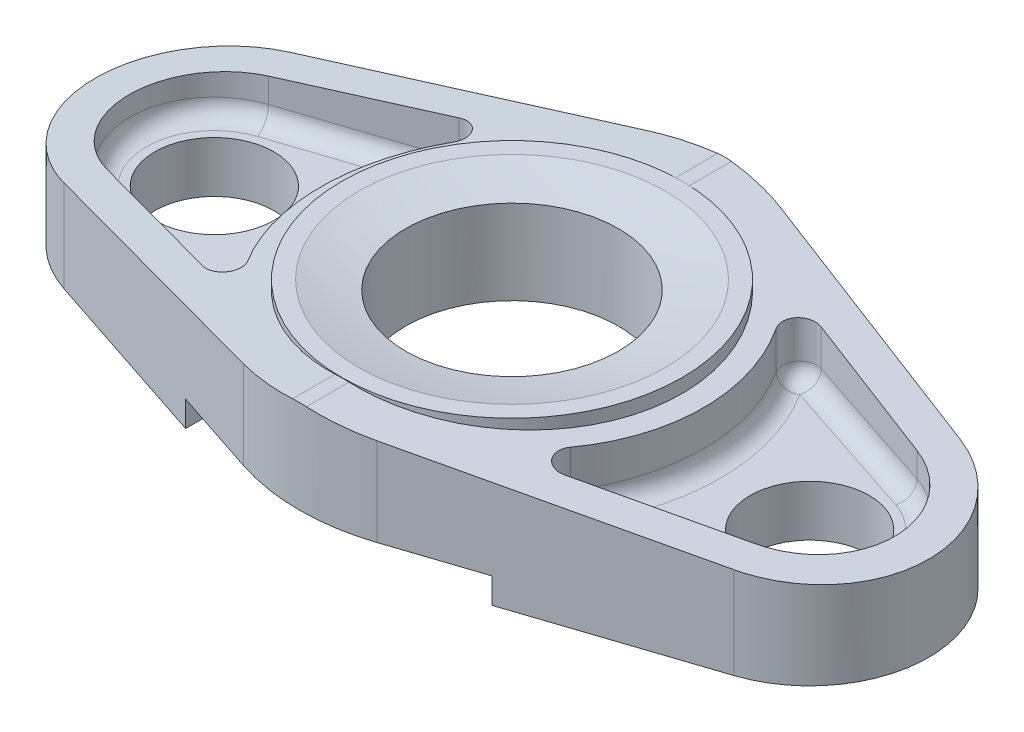
from build123d import *
from build123d.topology import SkipClean

# Parameters (mm, degrees)
EXTRUDE_1_DEPTH          = 14
CUT_EXTRUDE_1_DEPTH      = 57.762663785
SKETCH_4_R               = 7
CUT_EXTRUDE_2_DEPTH      = 57.762663785
CUT_EXTRUDE_START        = 6
CUT_EXTRUDE_3_DEPTH      = 51.762663785
SKETCH_7_R               = 20
EXTRUDE_2_DEPTH          = 14
CUT_EXTRUDE_4_DEPTH      = 57.762663785
CUT_EXTRUDE_4_DEPTH_BACK = 57.762663785
SKETCH_6_W               = 36
SKETCH_6_H               = 3
CUT_EXTRUDE_5_DEPTH      = 57.098128311
CUT_EXTRUDE_5_DEPTH_BACK = 57.098128311
SKETCH_9_R               = 12.5
FILLET_1_R               = 10
FILLET_4_R               = 2


with BuildPart() as part:
    # 草图2 → 凸台-拉伸1 (new body)
    with BuildSketch(Plane(origin=(0, 0, 0), x_dir=(1, 0, 0), z_dir=(0, 1, 0))):
        with BuildLine():
            Line((7.857142857, 23.733211037), (39.4, 13.290598181))
            ThreePointArc((39.4, 13.290598181), (49, 0), (39.4, -13.290598181))
            Line((39.4, -13.290598181), (7.857142857, -23.733211037))
            ThreePointArc((7.857142857, -23.733211037), (0, -25), (-7.857142857, -23.733211037))
            Line((-7.857142857, -23.733211037), (-39.4, -13.290598181))
            ThreePointArc((-39.4, -13.290598181), (-49, 0), (-39.4, 13.290598181))
            Line((-39.4, 13.290598181), (-7.857142857, 23.733211037))
            ThreePointArc((-7.857142857, 23.733211037), (0, 25), (7.857142857, 23.733211037))
        make_face()
    extrude(amount=EXTRUDE_1_DEPTH)

    # 草图3 → 切除-拉伸1 (cut, symmetric)
    with BuildSketch(Plane.XY):
        Polygon((-255.331422272, -6.84338141), (-49, 10), (0, 14), (206.331422272, 30.84338141), (172.644659452, 443.506225953), (-289.018185091, 405.819463133), align=None)
    cut_extrude_1 = extrude(amount=CUT_EXTRUDE_1_DEPTH, both=True, mode=Mode.SUBTRACT)

    # 镜向1: 切除-拉伸1 across plane
    add(cut_extrude_1.mirror(Plane(origin=(0, 0, 0), x_dir=(0, 0, 1), z_dir=(1, 0, 0))), mode=Mode.SUBTRACT)

    # 草图4 → 切除-拉伸2 (cut, through all)
    with BuildSketch(Plane.XZ):
        with Locations(Location((-35, 0, 0), (0, 0, 270))):
            Circle(SKETCH_4_R)
        with Locations((35, 0)):
            Circle(SKETCH_4_R)
    extrude(amount=-CUT_EXTRUDE_2_DEPTH, mode=Mode.SUBTRACT)

    # 草图5 → 切除-拉伸3 (cut, through all)
    with BuildSketch(Plane(origin=(0, 0, 0), x_dir=(1, 0, 0), z_dir=(0, 1, 0)).offset(CUT_EXTRUDE_START)):
        with BuildLine():
            Line((-38.142857143, -9.493284415), (-14.26843517, -17.397176719))
            ThreePointArc((-14.26843517, -17.397176719), (-22.5, 0), (-14.26843517, 17.397176719))
            Line((-14.26843517, 17.397176719), (-38.142857143, 9.493284415))
            ThreePointArc((-38.142857143, 9.493284415), (-45, 0), (-38.142857143, -9.493284415))
        make_face()
    cut_extrude_3 = extrude(amount=CUT_EXTRUDE_3_DEPTH, mode=Mode.SUBTRACT)

    # 镜向2: 切除-拉伸3 across plane
    add(cut_extrude_3.mirror(Plane(origin=(0, 0, 0), x_dir=(0, 0, 1), z_dir=(1, 0, 0))), mode=Mode.SUBTRACT)

    # 草图7 → 凸台-拉伸2 (add)
    with BuildSketch(Plane(origin=(0, 0, 0), x_dir=(1, 0, 0), z_dir=(0, 1, 0))):
        Circle(SKETCH_7_R)
    extrude(amount=EXTRUDE_2_DEPTH)

    # 草图6 → 切除-拉伸4 (cut, two sides: drawn at the far end of the back side and taken through both)
    with BuildSketch(Plane.XY.offset(-CUT_EXTRUDE_4_DEPTH_BACK)):
        with Locations((0, 1.5)):
            Rectangle(SKETCH_6_W, SKETCH_6_H)
    extrude(amount=CUT_EXTRUDE_4_DEPTH + CUT_EXTRUDE_4_DEPTH_BACK, mode=Mode.SUBTRACT)

    # 草图8 → 切除-旋转3 (revolve, cut)
    with SkipClean():  # the faces are left unmerged after this step: merging them gives an invalid solid
        with BuildSketch(Plane.XY):
            with BuildLine():
                ThreePointArc((0, 11.94870108), (9.058253519, 12.463180114), (18, 14))
                Line((18, 14), (0, 14))
                Line((0, 14), (0, 11.94870108))
            make_face()
            with BuildLine():
                Line((0, 11.94870108), (0, 14))
                Line((0, 14), (-18, 14))
                ThreePointArc((-18, 14), (-9.058253519, 12.463180114), (0, 11.94870108))
            make_face()
        revolve(axis=Axis((0, -0.298834831, 0), (0, 1, 0)), mode=Mode.SUBTRACT)
    add(part.part.scale(1), mode=Mode.REPLACE)  # the faces are merged on a copy

    # 草图9 → 切除-拉伸5 (cut, two sides: drawn at the far end of the back side and taken through both)
    with BuildSketch(Plane.XZ.offset(-3).offset(-CUT_EXTRUDE_5_DEPTH_BACK)):
        Circle(SKETCH_9_R)
    extrude(amount=CUT_EXTRUDE_5_DEPTH + CUT_EXTRUDE_5_DEPTH_BACK, mode=Mode.SUBTRACT)

    # 圆角1
    # the kernel refuses this fillet: 10 mm, written as the material it takes off along each edge
    with BuildSketch(Plane(origin=(0, 14, 17.959183673), x_dir=(0.9966846158226077, -0.08136200945491137, 0), z_dir=(0, 0, 1))) as fillet_1_piece_1_section:
        with BuildLine():
            CenterArc((FILLET_1_R * 0.0816326530612, -FILLET_1_R), FILLET_1_R, 90, 9.333716743)
            Line((-FILLET_1_R * 0.080551873211, -FILLET_1_R * 0.0132395531651), (0, 0))
            Line((0, 0), (FILLET_1_R * 0.0816326530612, 0))
        make_face()
    fillet_1_piece_1 = extrude(amount=9.081632653, mode=Mode.PRIVATE)
    fillet_1_piece_1 = fillet_1_piece_1 - Plane(origin=(0, 13.973401813, 0), x_dir=(1, 0, 0), z_dir=(0, -1, 0)) * Cylinder(20, 22, mode=Mode.PRIVATE)
    add(fillet_1_piece_1, mode=Mode.SUBTRACT)
    with BuildSketch(Plane(origin=(0, 14, -27.040816327), x_dir=(0.9966846158226077, -0.08136200945491137, 0), z_dir=(0, 0, 1))) as fillet_1_piece_2_section:
        with BuildLine():
            CenterArc((FILLET_1_R * 0.0816326530612, -FILLET_1_R), FILLET_1_R, 90, 9.333716743)
            Line((-FILLET_1_R * 0.080551873211, -FILLET_1_R * 0.0132395531651), (0, 0))
            Line((0, 0), (FILLET_1_R * 0.0816326530612, 0))
        make_face()
    fillet_1_piece_2 = extrude(amount=9.081632653, mode=Mode.PRIVATE)
    fillet_1_piece_2 = fillet_1_piece_2 - Plane(origin=(0, 13.973401813, 0), x_dir=(1, 0, 0), z_dir=(0, -1, 0)) * Cylinder(20, 22, mode=Mode.PRIVATE)
    add(fillet_1_piece_2, mode=Mode.SUBTRACT)

    # 圆角4
    fillet_4_edges = [part.edges().sort_by_distance(p)[0] for p in [
        (26.205646157, 6, 13.445230567),
        (45, 6, 0),
        (-26.205646157, 6, 13.445230567),
        (-45, 6, 0),
        (-14.26843517, 9.417614891, 17.397176719),
        (14.26843517, 9.417614891, 17.397176719),
        (26.205646157, 6, -13.445230567),
        (14.26843517, 9.417614891, -17.397176719),
        (22.5, 6, 0),
        (-14.26843517, 9.417614891, -17.397176719),
        (-22.5, 6, 0),
        (-26.205646157, 6, -13.445230567),
    ]]
    fillet(fillet_4_edges, radius=FILLET_4_R)


solid = part.part
